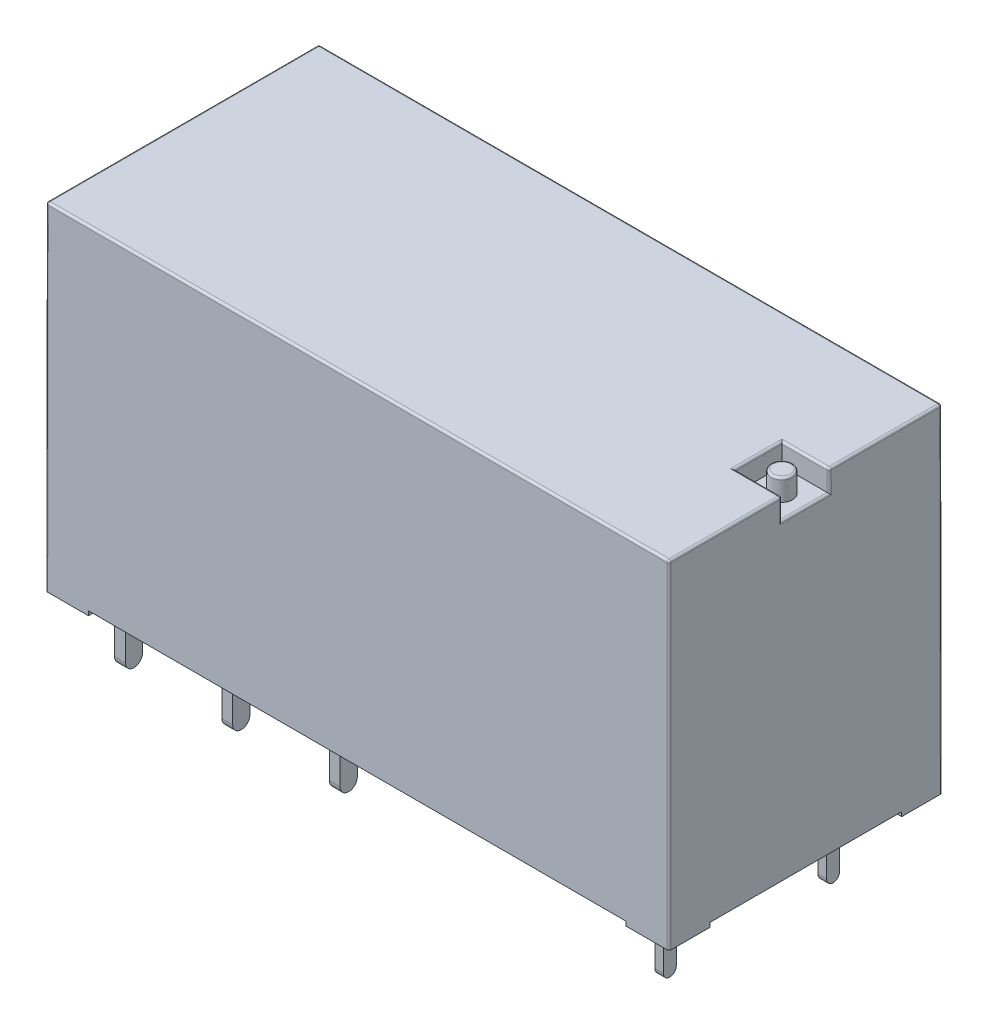
from build123d import *

# Parameters (mm, degrees)
SKETCH1_W           = 29
SKETCH1_H           = 12.7
BOSS_EXTRUDE1_DEPTH = 15.7
BOSS_EXTRUDE1_DRAFT = 0.05
CUT_EXTRUDE1_DEPTH  = 0.2
SKETCH3_W           = 0.4
SKETCH3_H           = 0.6
SKETCH3_W_2         = 0.5
SKETCH3_H_2         = 0.8
BOSS_EXTRUDE2_DEPTH = 3.8
FILLET1_R           = 0.3
FILLET2_R           = 0.4
SKETCH4_W           = 3.182056495
SKETCH4_H           = 2.2
SKETCH4_R           = 0.5
CUT_EXTRUDE2_DEPTH  = 1
FILLET3_R           = 0.1


with BuildPart() as part:
    # Sketch1 → Boss-Extrude1 (with draft: the straight prism first)
    with BuildSketch(Plane(origin=(0, 0, 0), x_dir=(1, 0, 0), z_dir=(0, 1, 0))):
        Rectangle(SKETCH1_W, SKETCH1_H)
    extrude(amount=-BOSS_EXTRUDE1_DEPTH)
    # Boss-Extrude1: the draft: its side faces are tilted about the plane it starts from
    boss_extrude1_sides = [part.faces().sort_by_distance(p)[0] for p in [
        (-14.5, -7.85, 0),
        (0, -7.85, 6.35),
        (14.5, -7.85, 0),
        (0, -7.85, -6.35),
    ]]
    draft(boss_extrude1_sides, Plane(origin=(0, 0, 0), x_dir=(1, 0, 0), z_dir=(0, 1, 0)), BOSS_EXTRUDE1_DRAFT)

    # Sketch2 → Cut-Extrude1 (cut)
    with BuildSketch(Plane(origin=(0, -15.7, 0), x_dir=(-1, 0, 0), z_dir=(0, -1, 0))):
        Polygon((14.013700838, -5.863700838), (12.513700838, -5.863700838), (12.513700838, -6.363700838), (-12.513700838, -6.363700838), (-12.513700838, -5.863700838), (-14.013700838, -5.863700838), (-14.013700838, -4.463700838), (-14.513700838, -4.463700838), (-14.513700838, 4.463700838), (-14.013700838, 4.463700838), (-14.013700838, 5.863700838), (-12.513700838, 5.863700838), (-12.513700838, 6.363700838), (12.513700838, 6.363700838), (12.513700838, 5.863700838), (14.013700838, 5.863700838), (14.013700838, 4.463700838), (14.513700838, 4.463700838), (14.513700838, -4.463700838), (14.013700838, -4.463700838), align=None)
    extrude(amount=-CUT_EXTRUDE1_DEPTH, mode=Mode.SUBTRACT)

    # Sketch3 → Boss-Extrude2 (add)
    with BuildSketch(Plane.XZ.offset(15.5)):
        with Locations((11.786299162, -3.8)):
            Rectangle(SKETCH3_W, SKETCH3_H)
        with Locations((11.786299162, 3.8)):
            Rectangle(SKETCH3_W, SKETCH3_H)
        with Locations((-8.213700838, 3.8)):
            Rectangle(SKETCH3_W_2, SKETCH3_H_2)
        with Locations((-13.213700838, -3.8)):
            Rectangle(SKETCH3_W_2, SKETCH3_H_2)
        with Locations((-13.213700838, 3.8)):
            Rectangle(SKETCH3_W_2, SKETCH3_H_2)
        with Locations((-8.213700838, -3.8)):
            Rectangle(SKETCH3_W_2, SKETCH3_H_2)
        with Locations((-3.213700838, 3.8)):
            Rectangle(SKETCH3_W_2, SKETCH3_H_2)
        with Locations((-3.213700838, -3.8)):
            Rectangle(SKETCH3_W_2, SKETCH3_H_2)
    extrude(amount=BOSS_EXTRUDE2_DEPTH)

    # Fillet1
    fillet1_edges = [part.edges().sort_by_distance(p)[0] for p in [
        (11.786299162, -19.3, 4.1),
        (11.786299162, -19.3, 3.5),
        (11.786299162, -19.3, -3.5),
        (11.786299162, -19.3, -4.1),
    ]]
    fillet(fillet1_edges, radius=FILLET1_R - 0.0001)  # a hair under: the kernel refuses the full size

    # Fillet2
    fillet2_edges = [part.edges().sort_by_distance(p)[0] for p in [
        (-13.213700838, -19.3, -4.2),
        (-13.213700838, -19.3, -3.4),
        (-8.213700838, -19.3, 4.2),
        (-8.213700838, -19.3, 3.4),
        (-13.213700838, -19.3, 3.4),
        (-13.213700838, -19.3, 4.2),
        (-8.213700838, -19.3, -4.2),
        (-8.213700838, -19.3, -3.4),
        (-3.213700838, -19.3, -4.2),
        (-3.213700838, -19.3, -3.4),
        (-3.213700838, -19.3, 3.4),
        (-3.213700838, -19.3, 4.2),
    ]]
    fillet(fillet2_edges, radius=FILLET2_R - 0.0001)  # a hair under: the kernel refuses the full size

    # Sketch4 → Cut-Extrude2 (cut)
    with BuildSketch(Plane(origin=(0, 0, 0), x_dir=(1, 0, 0), z_dir=(0, 1, 0))):
        with Locations((13.891028247, 0)):
            Rectangle(SKETCH4_W, SKETCH4_H)
        with Locations(Location((13.4, 0, 0), (0, 0, 270))):
            Circle(SKETCH4_R, mode=Mode.SUBTRACT)
    extrude(amount=-CUT_EXTRUDE2_DEPTH, mode=Mode.SUBTRACT)

    # Fillet3
    fillet3_edges = [part.edges().sort_by_distance(p)[0] for p in [
        (14.5, 0, -3.725),
        (13.4, 0, -1.1),
        (14.500872665, -1, 0),
        (14.500436332, -0.5, -1.1),
        (14.500436332, -0.5, 1.1),
        (13.4, 0, 1.1),
        (12.3, 0, 0),
        (13.4, 0, -0.5),
        (0, 0, 6.35),
        (-14.5, 0, 0),
        (0, 0, -6.35),
        (14.5, 0, 3.725),
        (14.506850419, -7.85, 6.356850419),
        (-14.506850419, -7.85, 6.356850419),
        (-14.506850419, -7.85, -6.356850419),
        (14.506850419, -7.85, -6.356850419),
    ]]
    fillet(fillet3_edges, radius=FILLET3_R)


solid = part.part
